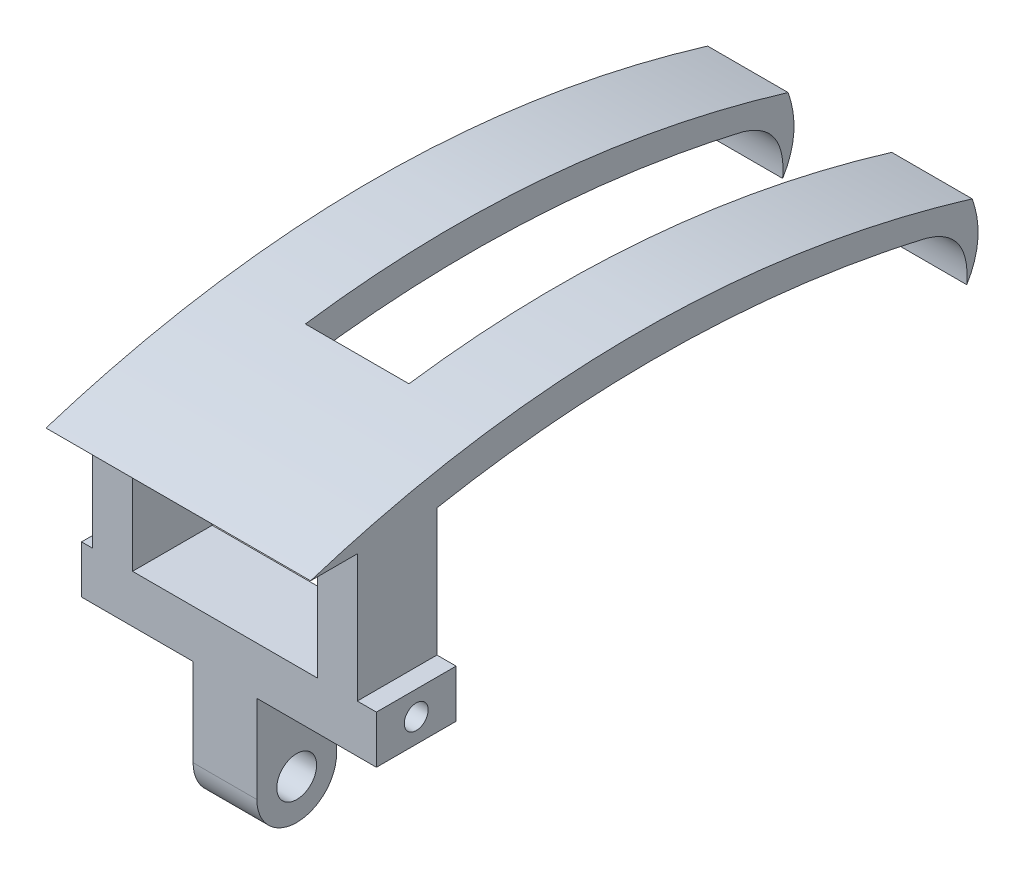
from build123d import *

# Parameters (mm, degrees)
SKETCH_1_W          = 180
SKETCH_1_H          = 50
EXTRUDE_1_DEPTH     = 30
SKETCH_2_W          = 40
SKETCH_2_H          = 50
EXTRUDE_2_DEPTH     = 80
FILLET_1_R          = 25
SKETCH_3_R          = 12.5
CUT_EXTRUDE_2_DEPTH = 145.913767462
SKETCH_7_W          = 25
SKETCH_7_H          = 50
EXTRUDE_5_DEPTH     = 80
EXTRUDE_6_REACH     = 213.019
SKETCH_9_W          = 65
SKETCH_9_H          = 330.441162185
CUT_EXTRUDE_4_DEPTH = 401.320460854
SKETCH_10_W         = 50
SKETCH_10_H         = 30
EXTRUDE_7_DEPTH     = 10
SKETCH_11_W         = 50
SKETCH_11_H         = 30
CUT_EXTRUDE_5_DEPTH = 5
SKETCH_12_R         = 7.5
CUT_EXTRUDE_6_DEPTH = 412.962042251


with BuildPart() as part:
    # 草图1 → 凸台-拉伸1 (new body)
    with BuildSketch(Plane(origin=(0, 0, 0), x_dir=(1, 0, 0), z_dir=(0, 1, 0))):
        with Locations((90, -25)):
            Rectangle(SKETCH_1_W, SKETCH_1_H)
    extrude(amount=EXTRUDE_1_DEPTH)

    # 草图2 → 凸台-拉伸2 (add)
    with BuildSketch(Plane.XZ):
        with Locations((90, 25)):
            Rectangle(SKETCH_2_W, SKETCH_2_H)
    extrude(amount=EXTRUDE_2_DEPTH)

    # 圆角1
    fillet_1_edges = [part.edges().sort_by_distance(p)[0] for p in [
        (90, -80, 50),
        (90, -80, 0),
    ]]
    fillet(fillet_1_edges, radius=FILLET_1_R - 0.0001)  # a hair under: the kernel refuses the full size

    # 草图3 → 切除-拉伸2 (cut, through all)
    with BuildSketch(Plane(origin=(110, 0, 0), x_dir=(0, 0, -1), z_dir=(1, 0, 0))):
        with Locations((-25, -55)):
            Circle(SKETCH_3_R)
    extrude(amount=-CUT_EXTRUDE_2_DEPTH, mode=Mode.SUBTRACT)

    # 草图7 → 凸台-拉伸5 (add)
    with BuildSketch(Plane(origin=(0, 30, 0), x_dir=(1, 0, 0), z_dir=(0, 1, 0))):
        with Locations((19.5, -25)):
            Rectangle(SKETCH_7_W, SKETCH_7_H)
        with Locations((160.5, -25)):
            Rectangle(SKETCH_7_W, SKETCH_7_H)
    extrude(amount=EXTRUDE_5_DEPTH)

    # 凸台-拉伸6: up to this face of the body (flat: up to its plane)
    extrude_6_end = Plane(part.part.faces().sort_by_distance((7, 70, 25))[0])
    # 草图8 → 凸台-拉伸6 (add, up to the picked face)
    with BuildSketch(Plane(origin=(173, 0, 0), x_dir=(0, 0, -1), z_dir=(1, 0, 0)), mode=Mode.PRIVATE) as extrude_6_sk1:
        with BuildLine():
            Line((0, 110), (-79.29372145, 110))
            add(Edge.make_bspline(
                [(-79.29372145, 110), (123.322725029, 174.375095478), (335.808448859, 110)],
                knots=[0, 0, 0, 1, 1, 1], degree=2))
            add(Edge.make_bspline(
                [(335.808448859, 110), (344.655163531, 85.008885119), (332.386652106, 65.024574676)],
                knots=[0, 0, 0, 1, 1, 1], degree=2))
            add(Edge.make_bspline(
                [(332.386652106, 65.024574676), (334.882025134, 94.793074398), (307.328252939, 102.88474179)],
                knots=[0, 0, 0, 1, 1, 1], degree=2))
            add(Edge.make_bspline(
                [(307.328252939, 102.88474179), (153.571097441, 138.708355764), (0, 110)],
                knots=[0, 0, 0, 1, 1, 1], degree=2))
        make_face()
    extrude_6_tool1 = split(extrude(extrude_6_sk1.sketch, amount=-EXTRUDE_6_REACH, mode=Mode.PRIVATE), bisect_by=extrude_6_end, keep=Keep.BOTH, mode=Mode.PRIVATE)
    add(extrude_6_tool1.solids().sort_by(Axis((173, 122.914419, -143.709252), (-1, 0, 0)))[0])

    # 草图9 → 切除-拉伸4 (cut, through all)
    with BuildSketch(Plane(origin=(0, 30, 0), x_dir=(1, 0, 0), z_dir=(0, 1, 0))):
        with Locations((90, 198.149530653)):
            Rectangle(SKETCH_9_W, SKETCH_9_H)
    extrude(amount=CUT_EXTRUDE_4_DEPTH, mode=Mode.SUBTRACT)

    # 草图10 → 凸台-拉伸7 (add)
    with BuildSketch(Plane(origin=(180, 0, 0), x_dir=(0, 0, -1), z_dir=(1, 0, 0))):
        with Locations((-25, 15)):
            Rectangle(SKETCH_10_W, SKETCH_10_H)
    extrude(amount=EXTRUDE_7_DEPTH)

    # 草图11 → 切除-拉伸5 (cut)
    with BuildSketch(Plane(origin=(190, 0, 0), x_dir=(0, 0, -1), z_dir=(1, 0, 0))):
        with Locations((-25, 15)):
            Rectangle(SKETCH_11_W, SKETCH_11_H)
    extrude(amount=-CUT_EXTRUDE_5_DEPTH, mode=Mode.SUBTRACT)

    # 草图12 → 切除-拉伸6 (cut, through all)
    with BuildSketch(Plane(origin=(185, 0, 0), x_dir=(0, 0, -1), z_dir=(1, 0, 0))):
        with Locations((-25, 15)):
            Circle(SKETCH_12_R)
    extrude(amount=-CUT_EXTRUDE_6_DEPTH, mode=Mode.SUBTRACT)


solid = part.part
